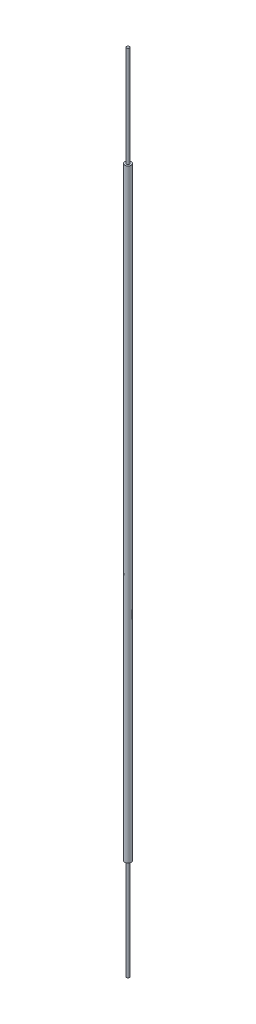
from build123d import *

# Parameters (mm, degrees)
SWEEP1_START        = -6
SWEEP1_OUTLINE_R    = 0.15875
SWEEP1_OUTLINE_R_2  = 0.0762
SWEEP1_DEPTH        = 30
SKETCH3_R           = 0.06985
BOSS_EXTRUDE1_DEPTH = 40


# Read off the part's stored shape, not the designer's step: Sweep1
with BuildPart() as part:
    # Sweep1 outline → Sweep1 (new body)
    with BuildSketch(Plane(origin=(0, 0, 0), x_dir=(1, 0, 0), z_dir=(0, 1, 0)).offset(SWEEP1_START)):
        Circle(SWEEP1_OUTLINE_R)
        Circle(SWEEP1_OUTLINE_R_2, mode=Mode.SUBTRACT)
    extrude(amount=SWEEP1_DEPTH)


with BuildPart() as body_2:
    # Sketch3 → Boss-Extrude1 (new body)
    with BuildSketch(Plane(origin=(0, 29, 0), x_dir=(1, 0, 0), z_dir=(0, 1, 0))):
        with Locations(Location((0, 0, 0), (0, 0, 270))):
            Circle(SKETCH3_R)
    extrude(amount=-BOSS_EXTRUDE1_DEPTH)


solid = Compound([part.part, body_2.part])
